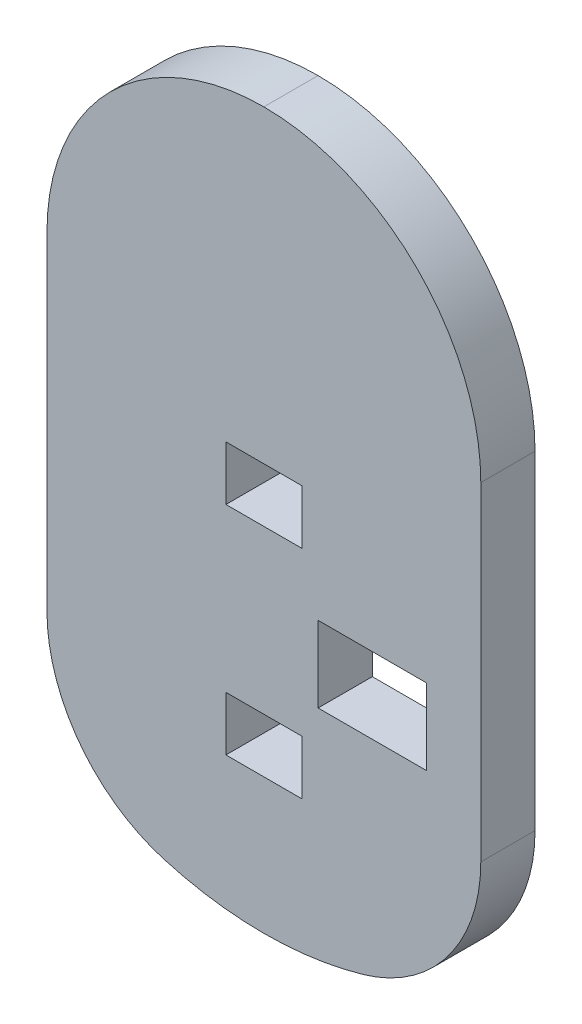
from build123d import *

# Parameters (mm, degrees)
SKETCH1_R           = 33
BOSS_EXTRUDE1_DEPTH = 5
CUT_EXTRUDE3_START  = -10
CUT_EXTRUDE3_DEPTH  = 10
FILLET2_R           = 20
FILLET3_R           = 15
SKETCH11_W          = 7
SKETCH11_H          = 5
CUT_EXTRUDE4_DEPTH  = 10
SKETCH12_W          = 10
SKETCH12_H          = 7
CUT_EXTRUDE5_DEPTH  = 10


with BuildPart() as part:
    # Sketch1 → Boss-Extrude1 (new body)
    with BuildSketch(Plane.XY):
        Circle(SKETCH1_R)
    extrude(amount=BOSS_EXTRUDE1_DEPTH)

    # Sketch10 → Cut-Extrude3 (cut)
    with BuildSketch(Plane.XY.offset(5).offset(CUT_EXTRUDE3_START)):
        with BuildLine():
            Line((-20, 26.248809497), (-20, -26.248809497))
            ThreePointArc((-20, -26.248809497), (-33, 0), (-20, 26.248809497))
        make_face()
        with BuildLine():
            Line((20, 26.248809497), (20, -26.248809497))
            ThreePointArc((20, -26.248809497), (33, 0), (20, 26.248809497))
        make_face()
    extrude(amount=CUT_EXTRUDE3_DEPTH, mode=Mode.SUBTRACT)

    # Fillet2
    fillet2_edges = [part.edges().sort_by_distance(p)[0] for p in [
        (-20, 26.248809497, 2.5),
        (20, 26.248809497, 2.5),
    ]]
    fillet(fillet2_edges, radius=FILLET2_R - 0.0001)  # a hair under: the kernel refuses the full size

    # Fillet3
    fillet3_edges = [part.edges().sort_by_distance(p)[0] for p in [
        (-20, -26.248809497, 2.5),
        (20, -26.248809497, 2.5),
    ]]
    fillet(fillet3_edges, radius=FILLET3_R)

    # Sketch11 → Cut-Extrude4 (cut)
    with BuildSketch(Plane.XY.offset(5)):
        with Locations((0, 2)):
            Rectangle(SKETCH11_W, SKETCH11_H)
        with Locations((0, -18)):
            Rectangle(SKETCH11_W, SKETCH11_H)
    extrude(amount=-CUT_EXTRUDE4_DEPTH, mode=Mode.SUBTRACT)

    # Sketch12 → Cut-Extrude5 (cut)
    with BuildSketch(Plane.XY.offset(5)):
        with Locations((10, -9)):
            Rectangle(SKETCH12_W, SKETCH12_H)
    extrude(amount=-CUT_EXTRUDE5_DEPTH, mode=Mode.SUBTRACT)


solid = part.part
